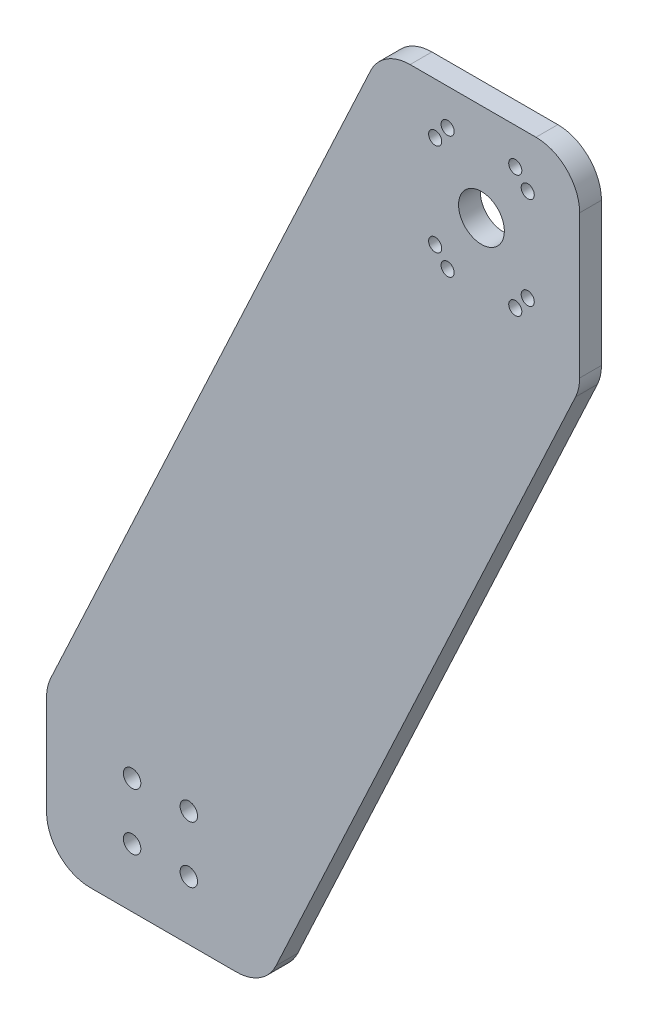
from build123d import *

# Parameters (mm, degrees)
SCHIZZO1_R                   = 4
SCHIZZO1_R_2                 = 10.5
SCHIZZO1_R_3                 = 3
ESTRUSIONE_ESTRUSIONE2_DEPTH = 10
SCHIZZO2_R                   = 2
TAGLIO_ESTRUSIONE1_DEPTH     = 15


with BuildPart() as part:
    # Schizzo1 → Estrusione-Estrusione2 (new body)
    with BuildSketch(Plane.XY):
        with BuildLine():
            Line((20, 0), (87.022408988, 0))
            ThreePointArc((87.022408988, 0), (97.768401155, 3.132171084), (105.148564729, 11.547634765))
            Line((105.148564729, 11.547634765), (242.445343973, 305.981528018))
            ThreePointArc((242.445343973, 305.981528018), (243.845108375, 310.105100974), (244.319188233, 314.433893253))
            Line((244.319188233, 314.433893253), (244.319188233, 380))
            ThreePointArc((244.319188233, 380), (238.461323856, 394.142135624), (224.319188233, 400))
            Line((224.319188233, 400), (166.622932407, 400))
            ThreePointArc((166.622932407, 400), (155.87694024, 396.867828916), (148.496776667, 388.452365235))
            Line((148.496776667, 388.452365235), (1.873844259, 74.018471982))
            ThreePointArc((1.873844259, 74.018471982), (0.474079858, 69.894899026), (0, 65.566106747))
            Line((0, 65.566106747), (0, 20))
            ThreePointArc((0, 20), (5.857864376, 5.857864376), (20, 0))
        make_face()
        with Locations((39.213445393, 53)):
            Circle(SCHIZZO1_R, mode=Mode.SUBTRACT)
        with Locations((65.213445393, 53)):
            Circle(SCHIZZO1_R, mode=Mode.SUBTRACT)
        with Locations((65.213445393, 27)):
            Circle(SCHIZZO1_R, mode=Mode.SUBTRACT)
        with Locations((39.213445393, 27)):
            Circle(SCHIZZO1_R, mode=Mode.SUBTRACT)
        with Locations((199.319188233, 355.469283566)):
            Circle(SCHIZZO1_R_2, mode=Mode.SUBTRACT)
        with Locations((183.819188233, 383.469283566)):
            Circle(SCHIZZO1_R_3, mode=Mode.SUBTRACT)
        with Locations((214.819188233, 383.469283566)):
            Circle(SCHIZZO1_R_3, mode=Mode.SUBTRACT)
        with Locations((220.532391668, 376.682487002)):
            Circle(SCHIZZO1_R_3, mode=Mode.SUBTRACT)
        with Locations((220.532391668, 334.256080131)):
            Circle(SCHIZZO1_R_3, mode=Mode.SUBTRACT)
        with Locations((214.819188233, 327.469283566)):
            Circle(SCHIZZO1_R_3, mode=Mode.SUBTRACT)
        with Locations((183.819188233, 327.469283566)):
            Circle(SCHIZZO1_R_3, mode=Mode.SUBTRACT)
        with Locations((178.105984797, 334.256080131)):
            Circle(SCHIZZO1_R_3, mode=Mode.SUBTRACT)
        with Locations((178.105984797, 376.682487002)):
            Circle(SCHIZZO1_R_3, mode=Mode.SUBTRACT)
    extrude(amount=-ESTRUSIONE_ESTRUSIONE2_DEPTH)

    # Schizzo2 → Taglio-Estrusione1 (cut)
    with BuildSketch(Plane.XZ):
        with Locations((53.511204494, -5)):
            Circle(SCHIZZO2_R)
        with Locations((81.011204494, -5)):
            Circle(SCHIZZO2_R)
        with Locations((26.011204494, -5)):
            Circle(SCHIZZO2_R)
    extrude(amount=-TAGLIO_ESTRUSIONE1_DEPTH, mode=Mode.SUBTRACT)


solid = part.part
